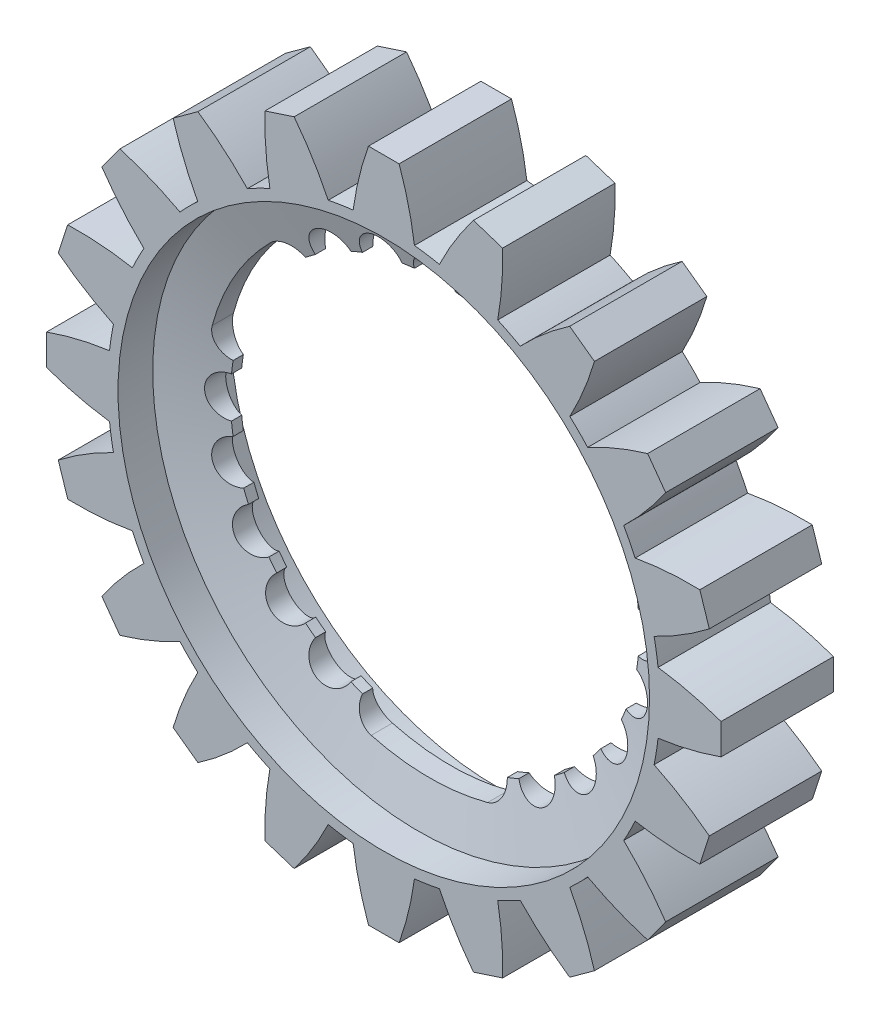
from build123d import *

# Parameters (mm, degrees)
SKETCH_1_R          = 13.5
EXTRUDE_1_DEPTH     = 5.5
SKETCH_2_R          = 10
CUT_EXTRUDE_1_DEPTH = 20.868316486
SKETCH_3_R          = 13
CUT_EXTRUDE_2_DEPTH = 1.5
CUT_EXTRUDE_START   = -1.5
SKETCH_4_R          = 13
CUT_EXTRUDE_3_DEPTH = 1.5
CHAMFER_1_SIZE      = 3.732050808
CHAMFER_1_SIZE_2    = 1
CUT_EXTRUDE_4_DEPTH = 20.868316486
EXTRUDE_START       = -5.5
EXTRUDE_2_DEPTH     = 5.5


with BuildPart() as part:
    # 草图1 → 凸台-拉伸1 (new body)
    with BuildSketch(Plane.XY):
        Circle(SKETCH_1_R)
    extrude(amount=EXTRUDE_1_DEPTH)

    # 草图2 → 切除-拉伸1 (cut, through all)
    with BuildSketch(Plane.XY.offset(5.5)):
        Circle(SKETCH_2_R)
    extrude(amount=-CUT_EXTRUDE_1_DEPTH, mode=Mode.SUBTRACT)

    # 草图3 → 切除-拉伸2 (cut)
    with BuildSketch(Plane.XY.offset(5.5)):
        Circle(SKETCH_3_R)
    extrude(amount=-CUT_EXTRUDE_2_DEPTH, mode=Mode.SUBTRACT)

    # 草图4 → 切除-拉伸3 (cut)
    with BuildSketch(Plane(origin=(0, 0, 0), x_dir=(-1, 0, 0), z_dir=(0, 0, -1)).offset(CUT_EXTRUDE_START)):
        with Locations(Location((0, 0, 0), (0, 0, 180))):
            Circle(SKETCH_4_R)
    extrude(amount=CUT_EXTRUDE_3_DEPTH, mode=Mode.SUBTRACT)

    # 倒角1
    # the kernel refuses this chamfer: 3.732050808, 1 mm, written as the material it takes off along each edge
    with BuildSketch(Plane(origin=(0, 0, 1.5), x_dir=(1, 0, 0), z_dir=(0, -1, 0))) as chamfer_1_piece_1_section:
        Polygon((10 + CHAMFER_1_SIZE, 0), (10, CHAMFER_1_SIZE_2), (10, 0), align=None)
    chamfer_1_piece_1 = revolve(axis=Axis((0, 0, 1.5), (0, 0, 1)), mode=Mode.PRIVATE)
    chamfer_1_piece_1 = chamfer_1_piece_1 & Plane(origin=(0, 0, 2.066231749), x_dir=(1, 0, 0), z_dir=(0, 0, 1)) * Cylinder(13, 55, mode=Mode.PRIVATE)
    add(chamfer_1_piece_1, mode=Mode.SUBTRACT)
    with BuildSketch(Plane(origin=(0, 0, 4), x_dir=(1, 0, 0), z_dir=(0, -1, 0))) as chamfer_1_piece_2_section:
        Polygon((10 + CHAMFER_1_SIZE, 0), (10, -CHAMFER_1_SIZE_2), (10, 0), align=None)
    chamfer_1_piece_2 = revolve(axis=Axis((0, 0, 4), (0, 0, 1)), mode=Mode.PRIVATE)
    chamfer_1_piece_2 = chamfer_1_piece_2 & Plane(origin=(0, 0, 3.433768251), x_dir=(1, 0, 0), z_dir=(0, 0, 1)) * Cylinder(13, 55, mode=Mode.PRIVATE)
    add(chamfer_1_piece_2, mode=Mode.SUBTRACT)

    # 草图5 → 切除-拉伸4 (cut, through all)
    with BuildSketch(Plane.XY.offset(5.5)):
        with BuildLine():
            ThreePointArc((-1.610531835, 9.86945729), (-2.588190451, 9.659258263), (-3.539967162, 9.352466653))
            ThreePointArc((-3.539967162, 9.352466653), (-2.847009496, 10.625184089), (-1.610531835, 9.86945729))
        make_face()
        with BuildLine():
            ThreePointArc((-4.110057805, 9.116327377), (-5.5, 9.526279442), (-5.839942195, 8.117578159))
            ThreePointArc((-5.839942195, 8.117578159), (-5, 8.660254038), (-4.110057805, 9.116327377))
        make_face()
        with BuildLine():
            ThreePointArc((0.998749218, 9.95), (0, 11), (-0.998749218, 9.95))
            ThreePointArc((-0.998749218, 9.95), (0, 10), (0.998749218, 9.95))
        make_face()
        with BuildLine():
            ThreePointArc((3.539967162, 9.352466653), (2.847009496, 10.625184089), (1.610531835, 9.86945729))
            ThreePointArc((1.610531835, 9.86945729), (2.588190451, 9.659258263), (3.539967162, 9.352466653))
        make_face()
        with BuildLine():
            ThreePointArc((5.839942195, 8.117578159), (5.5, 9.526279442), (4.110057805, 9.116327377))
            ThreePointArc((4.110057805, 9.116327377), (5, 8.660254038), (5.839942195, 8.117578159))
        make_face()
        with BuildLine():
            ThreePointArc((-6.329490128, 7.741934817), (-7.046059991, 8.070755067), (-7.778174593, 7.778174593))
            ThreePointArc((-7.778174593, 7.778174593), (-9.526279442, 5.5), (-10.625184089, 2.847009496))
            ThreePointArc((-10.625184089, 2.847009496), (-10.512508911, 2.066689415), (-9.86945729, 1.610531835))
            ThreePointArc((-9.86945729, 1.610531835), (-8.660254038, 5), (-6.329490128, 7.741934817))
        make_face()
        with BuildLine():
            ThreePointArc((7.778174593, 7.778174593), (7.046059991, 8.070755067), (6.329490128, 7.741934817))
            ThreePointArc((6.329490128, 7.741934817), (8.660254038, 5), (9.86945729, 1.610531835))
            ThreePointArc((9.86945729, 1.610531835), (10.512508911, 2.066689415), (10.625184089, 2.847009496))
            ThreePointArc((10.625184089, 2.847009496), (9.526279442, 5.5), (7.778174593, 7.778174593))
        make_face()
        with BuildLine():
            ThreePointArc((-9.95, 0.998749218), (-11, 0), (-9.95, -0.998749218))
            ThreePointArc((-9.95, -0.998749218), (-10, 0), (-9.95, 0.998749218))
        make_face()
        with BuildLine():
            ThreePointArc((-9.86945729, -1.610531835), (-10.625184089, -2.847009496), (-9.352466653, -3.539967162))
            ThreePointArc((-9.352466653, -3.539967162), (-9.659258263, -2.588190451), (-9.86945729, -1.610531835))
        make_face()
        with BuildLine():
            ThreePointArc((-9.116327377, -4.110057805), (-9.526279442, -5.5), (-8.117578159, -5.839942195))
            ThreePointArc((-8.117578159, -5.839942195), (-8.660254038, -5), (-9.116327377, -4.110057805))
        make_face()
        with BuildLine():
            ThreePointArc((-7.741934817, -6.329490128), (-7.778174593, -7.778174593), (-6.329490128, -7.741934817))
            ThreePointArc((-6.329490128, -7.741934817), (-7.071067812, -7.071067812), (-7.741934817, -6.329490128))
        make_face()
        with BuildLine():
            ThreePointArc((-5.839942195, -8.117578159), (-5.5, -9.526279442), (-4.110057805, -9.116327377))
            ThreePointArc((-4.110057805, -9.116327377), (-5, -8.660254038), (-5.839942195, -8.117578159))
        make_face()
        with BuildLine():
            ThreePointArc((-3.539967162, -9.352466653), (-3.466448921, -10.137444482), (-2.847009496, -10.625184089))
            ThreePointArc((-2.847009496, -10.625184089), (0, -11), (2.847009496, -10.625184089))
            ThreePointArc((2.847009496, -10.625184089), (3.466448921, -10.137444482), (3.539967162, -9.352466653))
            ThreePointArc((3.539967162, -9.352466653), (0, -10), (-3.539967162, -9.352466653))
        make_face()
        with BuildLine():
            ThreePointArc((7.741934817, -6.329490128), (7.071067812, -7.071067812), (6.329490128, -7.741934817))
            ThreePointArc((6.329490128, -7.741934817), (7.778174593, -7.778174593), (7.741934817, -6.329490128))
        make_face()
        with BuildLine():
            ThreePointArc((9.116327377, -4.110057805), (8.660254038, -5), (8.117578159, -5.839942195))
            ThreePointArc((8.117578159, -5.839942195), (9.526279442, -5.5), (9.116327377, -4.110057805))
        make_face()
        with BuildLine():
            ThreePointArc((9.86945729, -1.610531835), (9.659258263, -2.588190451), (9.352466653, -3.539967162))
            ThreePointArc((9.352466653, -3.539967162), (10.625184089, -2.847009496), (9.86945729, -1.610531835))
        make_face()
        with BuildLine():
            ThreePointArc((5.839942195, -8.117578159), (5.5, -9.526279442), (4.110057805, -9.116327377))
            ThreePointArc((4.110057805, -9.116327377), (5, -8.660254038), (5.839942195, -8.117578159))
        make_face()
        with BuildLine():
            ThreePointArc((9.95, 0.998749218), (11, 0), (9.95, -0.998749218))
            ThreePointArc((9.95, -0.998749218), (10, 0), (9.95, 0.998749218))
        make_face()
    extrude(amount=-CUT_EXTRUDE_4_DEPTH, mode=Mode.SUBTRACT)

    # 草图6 → 凸台-拉伸2 (add)
    with BuildSketch(Plane.XY.offset(5.5).offset(EXTRUDE_START)):
        with BuildLine():
            Line((5.812072794, 15.460669773), (4.38548802, 15.924195265))
            ThreePointArc((4.38548802, 15.924195265), (3.48195608, 14.617198294), (2.719313259, 13.223287617))
            ThreePointArc((2.719313259, 13.223287617), (4.171729424, 12.83926297), (5.572482808, 12.296236634))
            ThreePointArc((5.572482808, 12.296236634), (5.774811944, 13.872204263), (5.812072794, 15.460669773))
        make_face()
        with BuildLine():
            Line((10.305219409, 12.907941468), (9.091693917, 13.789619346))
            ThreePointArc((9.091693917, 13.789619346), (7.828499702, 12.825798085), (6.67244119, 11.735779845))
            ThreePointArc((6.67244119, 11.735779845), (7.935100906, 10.921729424), (9.099492173, 9.972424088))
            ThreePointArc((9.099492173, 9.972424088), (9.778919397, 11.40873523), (10.305219409, 12.907941468))
        make_face()
        with BuildLine():
            Line((0.75, 16.5), (-0.75, 16.5))
            ThreePointArc((-0.75, 16.5), (-1.205425663, 14.97776529), (-1.5, 13.416407865))
            ThreePointArc((-1.5, 13.416407865), (0, 13.5), (1.5, 13.416407865))
            ThreePointArc((1.5, 13.416407865), (1.205425663, 14.97776529), (0.75, 16.5))
        make_face()
        with BuildLine():
            Line((13.789619346, 9.091693917), (12.907941468, 10.305219409))
            ThreePointArc((12.907941468, 10.305219409), (11.40873523, 9.778919397), (9.972424088, 9.099492173))
            ThreePointArc((9.972424088, 9.099492173), (10.921729424, 7.935100906), (11.735779845, 6.67244119))
            ThreePointArc((11.735779845, 6.67244119), (12.825798085, 7.828499702), (13.789619346, 9.091693917))
        make_face()
        with BuildLine():
            Line((15.924195265, 4.38548802), (15.460669773, 5.812072794))
            ThreePointArc((15.460669773, 5.812072794), (13.872204263, 5.774811944), (12.296236634, 5.572482808))
            ThreePointArc((12.296236634, 5.572482808), (12.83926297, 4.171729424), (13.223287617, 2.719313259))
            ThreePointArc((13.223287617, 2.719313259), (14.617198294, 3.48195608), (15.924195265, 4.38548802))
        make_face()
        with BuildLine():
            Line((16.5, -0.75), (16.5, 0.75))
            ThreePointArc((16.5, 0.75), (14.97776529, 1.205425663), (13.416407865, 1.5))
            ThreePointArc((13.416407865, 1.5), (13.5, 0), (13.416407865, -1.5))
            ThreePointArc((13.416407865, -1.5), (14.97776529, -1.205425663), (16.5, -0.75))
        make_face()
        with BuildLine():
            Line((15.460669773, -5.812072794), (15.924195265, -4.38548802))
            ThreePointArc((15.924195265, -4.38548802), (14.617198294, -3.48195608), (13.223287617, -2.719313259))
            ThreePointArc((13.223287617, -2.719313259), (12.83926297, -4.171729424), (12.296236634, -5.572482808))
            ThreePointArc((12.296236634, -5.572482808), (13.872204263, -5.774811944), (15.460669773, -5.812072794))
        make_face()
        with BuildLine():
            Line((12.907941468, -10.305219409), (13.789619346, -9.091693917))
            ThreePointArc((13.789619346, -9.091693917), (12.825798085, -7.828499702), (11.735779845, -6.67244119))
            ThreePointArc((11.735779845, -6.67244119), (10.921729424, -7.935100906), (9.972424088, -9.099492173))
            ThreePointArc((9.972424088, -9.099492173), (11.40873523, -9.778919397), (12.907941468, -10.305219409))
        make_face()
        with BuildLine():
            Line((9.091693917, -13.789619346), (10.305219409, -12.907941468))
            ThreePointArc((10.305219409, -12.907941468), (9.778919397, -11.40873523), (9.099492173, -9.972424088))
            ThreePointArc((9.099492173, -9.972424088), (7.935100906, -10.921729424), (6.67244119, -11.735779845))
            ThreePointArc((6.67244119, -11.735779845), (7.828499702, -12.825798085), (9.091693917, -13.789619346))
        make_face()
        with BuildLine():
            Line((4.38548802, -15.924195265), (5.812072794, -15.460669773))
            ThreePointArc((5.812072794, -15.460669773), (5.774811944, -13.872204263), (5.572482808, -12.296236634))
            ThreePointArc((5.572482808, -12.296236634), (4.171729424, -12.83926297), (2.719313259, -13.223287617))
            ThreePointArc((2.719313259, -13.223287617), (3.48195608, -14.617198294), (4.38548802, -15.924195265))
        make_face()
        with BuildLine():
            Line((-0.75, -16.5), (0.75, -16.5))
            ThreePointArc((0.75, -16.5), (1.205425663, -14.97776529), (1.5, -13.416407865))
            ThreePointArc((1.5, -13.416407865), (0, -13.5), (-1.5, -13.416407865))
            ThreePointArc((-1.5, -13.416407865), (-1.205425663, -14.97776529), (-0.75, -16.5))
        make_face()
        with BuildLine():
            Line((-5.812072794, -15.460669773), (-4.38548802, -15.924195265))
            ThreePointArc((-4.38548802, -15.924195265), (-3.48195608, -14.617198294), (-2.719313259, -13.223287617))
            ThreePointArc((-2.719313259, -13.223287617), (-4.171729424, -12.83926297), (-5.572482808, -12.296236634))
            ThreePointArc((-5.572482808, -12.296236634), (-5.774811944, -13.872204263), (-5.812072794, -15.460669773))
        make_face()
        with BuildLine():
            Line((-10.305219409, -12.907941468), (-9.091693917, -13.789619346))
            ThreePointArc((-9.091693917, -13.789619346), (-7.828499702, -12.825798085), (-6.67244119, -11.735779845))
            ThreePointArc((-6.67244119, -11.735779845), (-7.935100906, -10.921729424), (-9.099492173, -9.972424088))
            ThreePointArc((-9.099492173, -9.972424088), (-9.778919397, -11.40873523), (-10.305219409, -12.907941468))
        make_face()
        with BuildLine():
            Line((-13.789619346, -9.091693917), (-12.907941468, -10.305219409))
            ThreePointArc((-12.907941468, -10.305219409), (-11.40873523, -9.778919397), (-9.972424088, -9.099492173))
            ThreePointArc((-9.972424088, -9.099492173), (-10.921729424, -7.935100906), (-11.735779845, -6.67244119))
            ThreePointArc((-11.735779845, -6.67244119), (-12.825798085, -7.828499702), (-13.789619346, -9.091693917))
        make_face()
        with BuildLine():
            Line((-15.924195265, -4.38548802), (-15.460669773, -5.812072794))
            ThreePointArc((-15.460669773, -5.812072794), (-13.872204263, -5.774811944), (-12.296236634, -5.572482808))
            ThreePointArc((-12.296236634, -5.572482808), (-12.83926297, -4.171729424), (-13.223287617, -2.719313259))
            ThreePointArc((-13.223287617, -2.719313259), (-14.617198294, -3.48195608), (-15.924195265, -4.38548802))
        make_face()
        with BuildLine():
            Line((-16.5, 0.75), (-16.5, -0.75))
            ThreePointArc((-16.5, -0.75), (-14.97776529, -1.205425663), (-13.416407865, -1.5))
            ThreePointArc((-13.416407865, -1.5), (-13.5, 0), (-13.416407865, 1.5))
            ThreePointArc((-13.416407865, 1.5), (-14.97776529, 1.205425663), (-16.5, 0.75))
        make_face()
        with BuildLine():
            Line((-15.460669773, 5.812072794), (-15.924195265, 4.38548802))
            ThreePointArc((-15.924195265, 4.38548802), (-14.617198294, 3.48195608), (-13.223287617, 2.719313259))
            ThreePointArc((-13.223287617, 2.719313259), (-12.83926297, 4.171729424), (-12.296236634, 5.572482808))
            ThreePointArc((-12.296236634, 5.572482808), (-13.872204263, 5.774811944), (-15.460669773, 5.812072794))
        make_face()
        with BuildLine():
            Line((-12.907941468, 10.305219409), (-13.789619346, 9.091693917))
            ThreePointArc((-13.789619346, 9.091693917), (-12.825798085, 7.828499702), (-11.735779845, 6.67244119))
            ThreePointArc((-11.735779845, 6.67244119), (-10.921729424, 7.935100906), (-9.972424088, 9.099492173))
            ThreePointArc((-9.972424088, 9.099492173), (-11.40873523, 9.778919397), (-12.907941468, 10.305219409))
        make_face()
        with BuildLine():
            Line((-9.091693917, 13.789619346), (-10.305219409, 12.907941468))
            ThreePointArc((-10.305219409, 12.907941468), (-9.778919397, 11.40873523), (-9.099492173, 9.972424088))
            ThreePointArc((-9.099492173, 9.972424088), (-7.935100906, 10.921729424), (-6.67244119, 11.735779845))
            ThreePointArc((-6.67244119, 11.735779845), (-7.828499702, 12.825798085), (-9.091693917, 13.789619346))
        make_face()
        with BuildLine():
            Line((-4.38548802, 15.924195265), (-5.812072794, 15.460669773))
            ThreePointArc((-5.812072794, 15.460669773), (-5.774811944, 13.872204263), (-5.572482808, 12.296236634))
            ThreePointArc((-5.572482808, 12.296236634), (-4.171729424, 12.83926297), (-2.719313259, 13.223287617))
            ThreePointArc((-2.719313259, 13.223287617), (-3.48195608, 14.617198294), (-4.38548802, 15.924195265))
        make_face()
    extrude(amount=EXTRUDE_2_DEPTH)


solid = part.part
